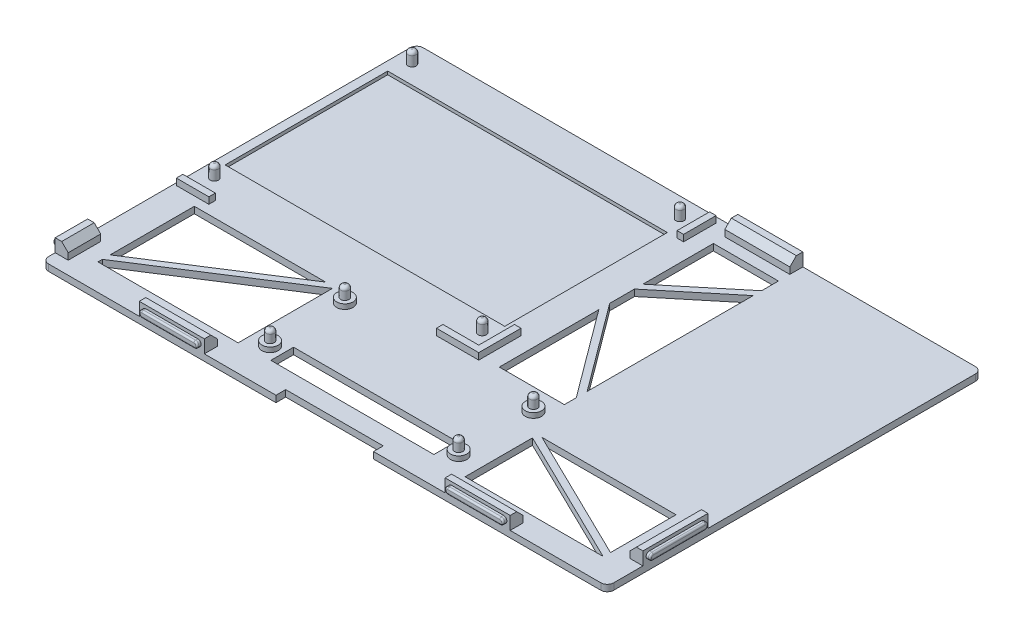
from build123d import *

# Parameters (mm, degrees)
SKETCH_1_W          = 173.8
SKETCH_1_H          = 115.2
EXTRUDE_1_DEPTH     = 2
SKETCH_3_W          = 2
SKETCH_3_H          = 10
SKETCH_3_W_2        = 10
SKETCH_3_H_2        = 2
EXTRUDE_2_DEPTH     = 2
SKETCH_4_R          = 1.25
EXTRUDE_3_DEPTH     = 4
FILLET_2_R          = 1
SKETCH_5_W          = 86
SKETCH_5_H          = 50
CUT_EXTRUDE_1_DEPTH = 1
SKETCH_8_R          = 2.5
EXTRUDE_4_DEPTH     = 1.5
SKETCH_8_3_R        = 1.25
EXTRUDE_5_DEPTH     = 5
FILLET_3_R          = 1
SKETCH_9_W          = 50.159646102
SKETCH_9_H          = 7
SKETCH_9_W_2        = 30
SKETCH_9_H_2        = 3
CUT_EXTRUDE_2_DEPTH = 2
SKETCH_10_W         = 20
SKETCH_10_H         = 4
SKETCH_10_W_2       = 4
SKETCH_10_H_2       = 20
SKETCH_10_H_3       = 10
EXTRUDE_6_DEPTH     = 4
CUT_EXTRUDE_3_DEPTH = 105.376098797
FILLET_1_R          = 2
CHAMFER_1_SIZE      = 2
EXTRUDE_8_DEPTH     = 1.2
EXTRUDE_9_DEPTH     = 1.2
EXTRUDE_11_DEPTH    = 1.2
EXTRUDE_12_DEPTH    = 1.2
FILLET_4_R          = 0.5


with BuildPart() as part:
    # 草圖1 → 填料-伸長1 (new body)
    with BuildSketch(Plane(origin=(0, 0, 0), x_dir=(1, 0, 0), z_dir=(0, 1, 0))):
        Rectangle(SKETCH_1_W, SKETCH_1_H)
    extrude(amount=EXTRUDE_1_DEPTH)

    # 草圖3 → 填料-伸長2 (add)
    with BuildSketch(Plane(origin=(0, 2, 0), x_dir=(1, 0, 0), z_dir=(0, 1, 0))):
        with Locations((5.84, 50.93)):
            Rectangle(SKETCH_3_W, SKETCH_3_H)
        Polygon((4.84, -14.07), (4.84, -4.07), (6.84, -4.07), (6.84, -14.07), (6.84, -15.07), (6.84, -17.07), (-6.16, -17.07), (-6.16, -15.07), (4.84, -15.07), align=None)
        with Locations((-81.16, -16.07)):
            Rectangle(SKETCH_3_W_2, SKETCH_3_H_2)
    extrude(amount=EXTRUDE_2_DEPTH)

    # 草圖4 → 填料-伸長3 (add)
    with BuildSketch(Plane(origin=(0, 2, 0), x_dir=(1, 0, 0), z_dir=(0, 1, 0))):
        with Locations((0.04, 51.63)):
            Circle(SKETCH_4_R)
        with Locations((0.04, -9.17)):
            Circle(SKETCH_4_R)
        with Locations((-82.36, -9.17)):
            Circle(SKETCH_4_R)
        with Locations((-82.36, 51.63)):
            Circle(SKETCH_4_R)
    extrude(amount=EXTRUDE_3_DEPTH)

    # 圓角2
    fillet_2_edges = [part.edges().sort_by_distance(p)[0] for p in [
        (-83.61, 6, -51.63),
        (-83.61, 6, 9.17),
        (-1.21, 6, 9.17),
        (-1.21, 6, -51.63),
    ]]
    fillet(fillet_2_edges, radius=FILLET_2_R)

    # 草圖5 → 除料-伸長1 (cut)
    with BuildSketch(Plane(origin=(0, 2, 0), x_dir=(1, 0, 0), z_dir=(0, 1, 0))):
        with Locations((-41.16, 20.93)):
            Rectangle(SKETCH_5_W, SKETCH_5_H)
    extrude(amount=-CUT_EXTRUDE_1_DEPTH, mode=Mode.SUBTRACT)

    # 草圖8 → 填料-伸長4 (add)
    with BuildSketch(Plane(origin=(0, 2, 0), x_dir=(1, 0, 0), z_dir=(0, 1, 0))):
        with Locations((29, -22.4)):
            Circle(SKETCH_8_R)
        with Locations((29, -45.4)):
            Circle(SKETCH_8_R)
        with Locations((-29, -45.4)):
            Circle(SKETCH_8_R)
        with Locations((-29, -22.4)):
            Circle(SKETCH_8_R)
    extrude(amount=EXTRUDE_4_DEPTH)

    # 草圖8<3> → 填料-伸長5 (add)
    with BuildSketch(Plane(origin=(0, 2, 0), x_dir=(1, 0, 0), z_dir=(0, 1, 0))):
        with Locations((29, -22.4)):
            Circle(SKETCH_8_3_R)
        with Locations((29, -45.4)):
            Circle(SKETCH_8_3_R)
        with Locations((-29, -45.4)):
            Circle(SKETCH_8_3_R)
        with Locations((-29, -22.4)):
            Circle(SKETCH_8_3_R)
    extrude(amount=EXTRUDE_5_DEPTH)

    # 圓角3
    fillet_3_edges = [part.edges().sort_by_distance(p)[0] for p in [
        (-30.25, 7, 45.4),
        (27.75, 7, 45.4),
        (27.75, 7, 22.4),
        (-30.25, 7, 22.4),
    ]]
    fillet(fillet_3_edges, radius=FILLET_3_R)

    # 草圖9 → 除料-伸長2 (cut)
    with BuildSketch(Plane(origin=(0, 2, 0), x_dir=(1, 0, 0), z_dir=(0, 1, 0))):
        with Locations((0, -45.6)):
            Rectangle(SKETCH_9_W, SKETCH_9_H)
        with Locations((0, -56.1)):
            Rectangle(SKETCH_9_W_2, SKETCH_9_H_2)
    extrude(amount=-CUT_EXTRUDE_2_DEPTH, mode=Mode.SUBTRACT)

    # 草圖10 → 填料-伸長6 (add)
    with BuildSketch(Plane(origin=(0, 2, 0), x_dir=(1, 0, 0), z_dir=(0, 1, 0))):
        with Locations((21.854715439, 55.6)):
            Rectangle(SKETCH_10_W, SKETCH_10_H)
        with Locations((84.9, -36.637998684)):
            Rectangle(SKETCH_10_W_2, SKETCH_10_H_2)
        with Locations((47.031889085, -55.6)):
            Rectangle(SKETCH_10_W, SKETCH_10_H)
        with Locations((-47.031889085, -55.6)):
            Rectangle(SKETCH_10_W, SKETCH_10_H)
        with Locations((-84.9, -48.6)):
            Rectangle(SKETCH_10_W_2, SKETCH_10_H_3)
    extrude(amount=EXTRUDE_6_DEPTH)

    # 草圖11 → 除料-伸長3 (cut, through all)
    with BuildSketch(Plane(origin=(0, 2, 0), x_dir=(1, 0, 0), z_dir=(0, 1, 0))):
        Polygon((-77.879578173, -45.722583606), (-37.497069547, -19.823892626), (-77.879578173, -19.823892626), align=None)
        Polygon((-77.879578173, -49.467196386), (-34.764514275, -49.467196386), (-34.764514275, -20.447382192), (-77.879578173, -48.098554803), align=None)
        Polygon((31.854715439, 44.917489498), (11.854715439, 28.410289152), (11.854715439, 50.090728689), (31.854715439, 50.090728689), align=None)
        Polygon((11.854715439, -15.752914676), (31.854715439, -15.752914676), (31.854715439, -12.091582027), (11.854715439, 14.843632999), align=None)
        Polygon((11.854715439, 25.817052443), (31.854715439, 42.324252788), (31.854715439, -8.736726131), (11.854715439, 18.198488896), align=None)
        Polygon((78.359380095, -48.062791021), (37.115806701, -27.915068386), (78.359380095, -27.915068386), align=None)
        Polygon((35.80419089, -29.5002187), (35.80419089, -50.229107424), (78.237445455, -50.229107424), align=None)
    extrude(amount=-CUT_EXTRUDE_3_DEPTH, mode=Mode.SUBTRACT)

    # 圓角1
    fillet_1_edges = [part.edges().sort_by_distance(p)[0] for p in [
        (86.9, 1, -57.6),
        (-86.9, 1, -57.6),
        (-86.9, 1, 57.6),
        (86.9, 1, 57.6),
    ]]
    fillet(fillet_1_edges, radius=FILLET_1_R)

    # 導角1
    chamfer_1_edges = [part.edges().sort_by_distance(p)[0] for p in [
        (82.9, 6, 36.637998684),
        (47.031889085, 6, 53.6),
        (-47.031889085, 6, 53.6),
        (-82.9, 6, 48.6),
        (21.854715439, 6, -53.6),
    ]]
    chamfer(chamfer_1_edges, length=CHAMFER_1_SIZE)

    # 草圖13 → 填料-伸長8 (add)
    with BuildSketch(Plane(origin=(86.9, 0, 0), x_dir=(0, 0, -1), z_dir=(1, 0, 0))):
        with BuildLine():
            Line((-44.637998684, 5), (-28.637998684, 5))
            ThreePointArc((-28.637998684, 5), (-27.637998684, 4), (-28.637998684, 3))
            Line((-28.637998684, 3), (-44.637998684, 3))
            ThreePointArc((-44.637998684, 3), (-45.637998684, 4), (-44.637998684, 5))
        make_face()
    extrude(amount=EXTRUDE_8_DEPTH)

    # 草圖14 → 填料-伸長9 (add)
    with BuildSketch(Plane(origin=(0, 0, -57.6), x_dir=(-1, 0, 0), z_dir=(0, 0, -1))):
        with BuildLine():
            Line((-29.854715439, 5), (-13.854715439, 5))
            ThreePointArc((-13.854715439, 5), (-12.854715439, 4), (-13.854715439, 3))
            Line((-13.854715439, 3), (-29.854715439, 3))
            ThreePointArc((-29.854715439, 3), (-30.854715439, 4), (-29.854715439, 5))
        make_face()
    extrude(amount=EXTRUDE_9_DEPTH)

    # 草圖15 → 填料-伸長11 (add)
    with BuildSketch(Plane.XY.offset(57.6)):
        with BuildLine():
            Line((-55.031889085, 5), (-39.031889085, 5))
            ThreePointArc((-39.031889085, 5), (-38.031889085, 4), (-39.031889085, 3))
            Line((-39.031889085, 3), (-55.031889085, 3))
            ThreePointArc((-55.031889085, 3), (-56.031889085, 4), (-55.031889085, 5))
        make_face()
        with BuildLine():
            Line((55.031889085, 5), (39.031889085, 5))
            ThreePointArc((39.031889085, 5), (38.031889085, 4), (39.031889085, 3))
            Line((39.031889085, 3), (55.031889085, 3))
            ThreePointArc((55.031889085, 3), (56.031889085, 4), (55.031889085, 5))
        make_face()
    extrude(amount=EXTRUDE_11_DEPTH)

    # 草圖16 → 填料-伸長12 (add)
    with BuildSketch(Plane.ZY.offset(86.9)):
        with BuildLine():
            Line((45.1, 5), (52.1, 5))
            ThreePointArc((52.1, 5), (53.1, 4), (52.1, 3))
            Line((52.1, 3), (45.1, 3))
            ThreePointArc((45.1, 3), (44.1, 4), (45.1, 5))
        make_face()
    extrude(amount=EXTRUDE_12_DEPTH)

    # 圓角4
    fillet_4_edges = [part.edges().sort_by_distance(p)[0] for p in [
        (12.854715439, 4, -58.8),
        (21.854715439, 3, -58.8),
        (30.854715439, 4, -58.8),
        (88.1, 4, 27.637998684),
        (88.1, 3, 36.637998684),
        (88.1, 4, 45.637998684),
        (56.031889085, 4, 58.8),
        (47.031889085, 3, 58.8),
        (38.031889085, 4, 58.8),
        (-88.1, 4, 53.1),
        (-88.1, 3, 48.6),
        (-88.1, 4, 44.1),
        (-38.031889085, 4, 58.8),
        (-47.031889085, 3, 58.8),
        (-56.031889085, 4, 58.8),
        (21.854715439, 5, -58.8),
        (88.1, 5, 36.637998684),
        (47.031889085, 5, 58.8),
        (-88.1, 5, 48.6),
        (-47.031889085, 5, 58.8),
    ]]
    fillet(fillet_4_edges, radius=FILLET_4_R)


solid = part.part
